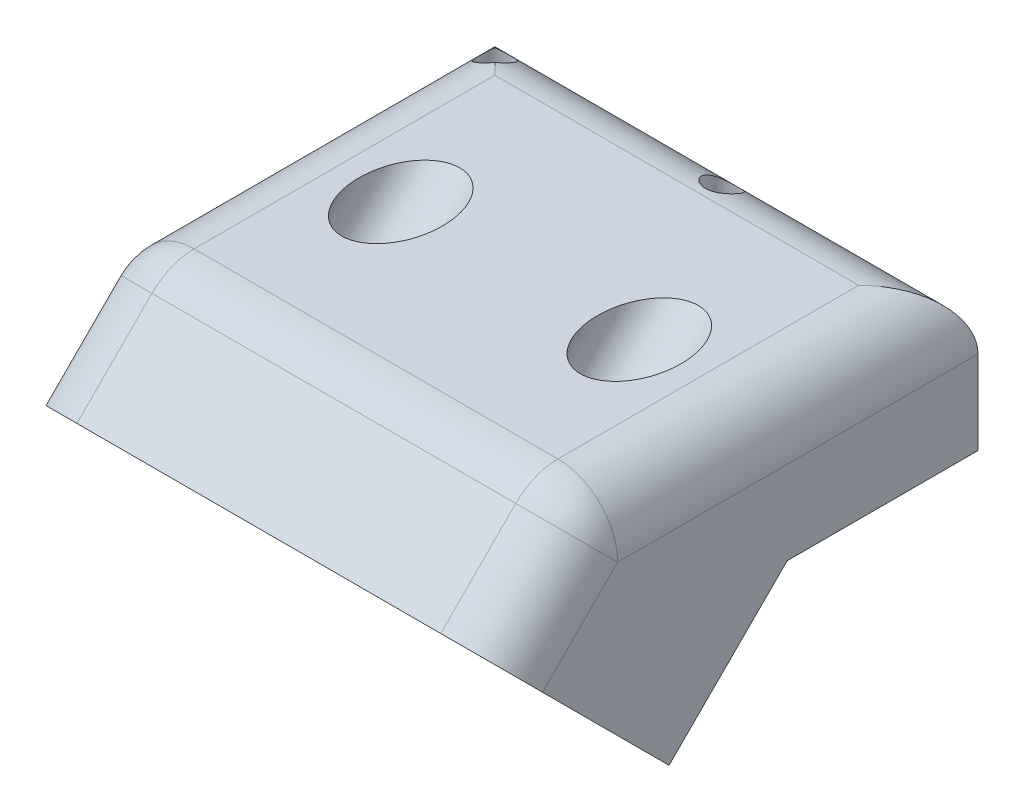
from build123d import *

# Parameters (mm, degrees)
SKETCH1_W           = 40.5
SKETCH1_H           = 16
SKETCH1_R           = 1.35
BOSS_EXTRUDE1_DEPTH = 12
BOSS_EXTRUDE2_START = 2
BOSS_EXTRUDE2_DEPTH = 10
BOSS_EXTRUDE3_DEPTH = 40.5
SKETCH4_R           = 2
CUT_EXTRUDE3_DEPTH  = 40.502331785
CUT_EXTRUDE4_START  = -3
SKETCH4_5_R         = 3.5
SKETCH4_5_R_2       = 2
CUT_EXTRUDE4_DEPTH  = 37.502331785
CHAMFER2_SIZE       = 1
FILLET2_R           = 5


with BuildPart() as part:
    # Sketch1 → Boss-Extrude1 (new body)
    with BuildSketch(Plane(origin=(0, 0, 0), x_dir=(1, 0, 0), z_dir=(0, 1, 0))):
        Rectangle(SKETCH1_W, SKETCH1_H)
        with Locations(Location((-17.25, 5, 0), (0, 0, 270))):
            Circle(SKETCH1_R, mode=Mode.SUBTRACT)
        with BuildLine():
            Line((-14.421572875, 6), (-1.078427125, 6))
            ThreePointArc((-1.078427125, 6), (1.75, 2), (4.578427125, 6))
            Line((4.578427125, 6), (18.25, 6))
            Line((18.25, 6), (18.25, -6))
            Line((18.25, -6), (-18.25, -6))
            Line((-18.25, -6), (-18.25, 2.171572875))
            ThreePointArc((-18.25, 2.171572875), (-15.128679656, 2.878679656), (-14.421572875, 6))
        make_face(mode=Mode.SUBTRACT)
        with Locations(Location((1.75, 5, 0), (0, 0, 270))):
            Circle(SKETCH1_R, mode=Mode.SUBTRACT)
    extrude(amount=BOSS_EXTRUDE1_DEPTH)

    # Sketch1<3> → Boss-Extrude2 (add)
    with BuildSketch(Plane(origin=(0, 0, 0), x_dir=(1, 0, 0), z_dir=(0, 1, 0)).offset(BOSS_EXTRUDE2_START)):
        with BuildLine():
            ThreePointArc((-14.25, 5), (-15.517949192, 2.550510257), (-18.25, 2.171572875))
            Line((-18.25, 2.171572875), (-18.25, -6))
            Line((-18.25, -6), (18.25, -6))
            Line((18.25, -6), (18.25, 6))
            Line((18.25, 6), (4.578427125, 6))
            ThreePointArc((4.578427125, 6), (4.706795679, 5.507305936), (4.75, 5))
            ThreePointArc((4.75, 5), (1.242694064, 2.043204321), (-1.078427125, 6))
            Line((-1.078427125, 6), (-14.421572875, 6))
            ThreePointArc((-14.421572875, 6), (-14.293204321, 5.507305936), (-14.25, 5))
        make_face()
    extrude(amount=BOSS_EXTRUDE2_DEPTH)

    # Sketch3 → Boss-Extrude3 (add)
    with BuildSketch(Plane.ZY.offset(20.25)):
        Polygon((8, 0), (17.899494937, -9.899494937), (32.04163056, 4.242640687), (24.284271247, 12), (8, 12), align=None)
    extrude(amount=-BOSS_EXTRUDE3_DEPTH)

    # Sketch4 → Cut-Extrude3 (cut, through all)
    with BuildSketch(Plane(origin=(0, -13.899494937, 13.899494937), x_dir=(1, 0, 0), z_dir=(0, -0.7071067811865437, 0.7071067811865513))):
        with Locations(Location((-10, 15.656854249, 0), (0, 0, 270))):
            Circle(SKETCH4_R)
        with Locations(Location((10, 15.656854249, 0), (0, 0, 270))):
            Circle(SKETCH4_R)
    extrude(amount=-CUT_EXTRUDE3_DEPTH, mode=Mode.SUBTRACT)

    # Sketch4<5> → Cut-Extrude4 (cut, through all)
    # profile 1 of 2: a face of its own
    with BuildSketch(Plane(origin=(0, -13.899494937, 13.899494937), x_dir=(1, 0, 0), z_dir=(0, -0.7071067811865437, 0.7071067811865513)).offset(CUT_EXTRUDE4_START)):
        with Locations(Location((10, 15.656854249, 0), (0, 0, 270))):
            Circle(SKETCH4_5_R)
        with Locations(Location((10, 15.656854249, 0), (0, 0, 270))):
            Circle(SKETCH4_5_R_2, mode=Mode.SUBTRACT)
    # profile 2 of 2: a face of its own
    with BuildSketch(Plane(origin=(0, -13.899494937, 13.899494937), x_dir=(1, 0, 0), z_dir=(0, -0.7071067811865437, 0.7071067811865513)).offset(CUT_EXTRUDE4_START)):
        with Locations(Location((-10, 15.656854249, 0), (0, 0, 90))):
            Circle(SKETCH4_5_R)
        with Locations(Location((-10, 15.656854249, 0), (0, 0, 270))):
            Circle(SKETCH4_5_R_2, mode=Mode.SUBTRACT)
    extrude(amount=-CUT_EXTRUDE4_DEPTH, mode=Mode.SUBTRACT)

    # Chamfer2
    chamfer2_edges = [part.edges().sort_by_distance(p)[0] for p in [
        (-10, 0.707106781, 24.263455967),
        (10, 0.707106781, 24.263455967),
    ]]
    chamfer(chamfer2_edges, length=CHAMFER2_SIZE)

    # Fillet2
    # the kernel refuses this fillet: 5 mm, written as the material it takes off along each edge
    with BuildSketch(Plane(origin=(15.25, 7, 22.213203436), x_dir=(0, 0.7071067811865516, 0.7071067811865435), z_dir=(1, 0, 0))) as fillet2_piece_1_section:
        Polygon((0, 0), (FILLET2_R, 0), (FILLET2_R, -FILLET2_R * 0.414213562373), (FILLET2_R * 0.707106781187, -FILLET2_R * 0.707106781187), align=None)
    fillet2_piece_1 = extrude(amount=FILLET2_R, mode=Mode.PRIVATE)
    fillet2_piece_1 = fillet2_piece_1 - Plane(origin=(15.25, 7, 22.213203436), x_dir=(0, -0.9238795325112877, -0.3826834323650871), z_dir=(1, 0, 0)) * Sphere(FILLET2_R, mode=Mode.PRIVATE)
    add(fillet2_piece_1, mode=Mode.SUBTRACT)
    with BuildSketch(Plane(origin=(-15.25, 7, 22.213203436), x_dir=(0, 0.7071067811865516, 0.7071067811865435), z_dir=(-1, 0, 0))) as fillet2_piece_2_section:
        Polygon((0, 0), (FILLET2_R, 0), (FILLET2_R, FILLET2_R * 0.414213562373), (FILLET2_R * 0.707106781187, FILLET2_R * 0.707106781187), align=None)
    fillet2_piece_2 = extrude(amount=FILLET2_R, mode=Mode.PRIVATE)
    fillet2_piece_2 = fillet2_piece_2 - Plane(origin=(-15.25, 7, 22.213203436), x_dir=(0, -0.9238795325112877, -0.3826834323650871), z_dir=(-1, 0, 0)) * Sphere(FILLET2_R, mode=Mode.PRIVATE)
    add(fillet2_piece_2, mode=Mode.SUBTRACT)
    with BuildSketch(Plane(origin=(20.25, -4.596194078, 40.880465325), x_dir=(0, -0.7071067811865516, -0.7071067811865435), z_dir=(0, 0.7071067811865435, -0.7071067811865516))) as fillet2_piece_3:
        with BuildLine():
            CenterArc((FILLET2_R, FILLET2_R), FILLET2_R, 180, 90)
            Line((0, FILLET2_R), (0, 0))
            Line((0, 0), (FILLET2_R, 0))
        make_face()
    extrude(amount=21.399494937, mode=Mode.SUBTRACT)
    with BuildSketch(Plane(origin=(-20.25, -4.596194078, 40.880465325), x_dir=(0, -0.7071067811865516, -0.7071067811865435), z_dir=(0, 0.7071067811865435, -0.7071067811865516))) as fillet2_piece_4:
        with BuildLine():
            CenterArc((FILLET2_R, -FILLET2_R), FILLET2_R, 90, 90)
            Line((0, -FILLET2_R), (0, 0))
            Line((0, 0), (FILLET2_R, 0))
        make_face()
    extrude(amount=21.399494937, mode=Mode.SUBTRACT)
    with BuildSketch(Plane(origin=(20.25, 12, -20.5), x_dir=(0, -1, 0), z_dir=(0, 0, 1)), Plane(origin=(-20.25, 12, 22.213203436), x_dir=(0, -1, 0), z_dir=(0, 0, -1))) as fillet2_piece_5:
        with BuildLine():
            CenterArc((FILLET2_R, -FILLET2_R), FILLET2_R, 90, 90)
            Line((0, -FILLET2_R), (0, 0))
            Line((0, 0), (FILLET2_R, 0))
        make_face()
    extrude(amount=42.713203436, mode=Mode.SUBTRACT)
    with BuildSketch(Plane(origin=(-15.25, 12, 24.284271247), x_dir=(0, -0.7071067811865432, 0.7071067811865519), z_dir=(1, 0, 0))) as fillet2_piece_6:
        with BuildLine():
            CenterArc((FILLET2_R * 0.414213562373, FILLET2_R), FILLET2_R, 225, 45)
            Line((-FILLET2_R * 0.292893218813, FILLET2_R * 0.292893218813), (0, 0))
            Line((0, 0), (FILLET2_R * 0.414213562373, 0))
        make_face()
    extrude(amount=30.5, mode=Mode.SUBTRACT)
    with BuildSketch(Plane(origin=(32.75, 12, -8), x_dir=(0, -1, 0), z_dir=(-1, 0, 0))) as fillet2_piece_7:
        with BuildLine():
            CenterArc((FILLET2_R, FILLET2_R), FILLET2_R, 180, 90)
            Line((0, FILLET2_R), (0, 0))
            Line((0, 0), (FILLET2_R, 0))
        make_face()
    extrude(amount=65.5, mode=Mode.SUBTRACT)


solid = part.part
